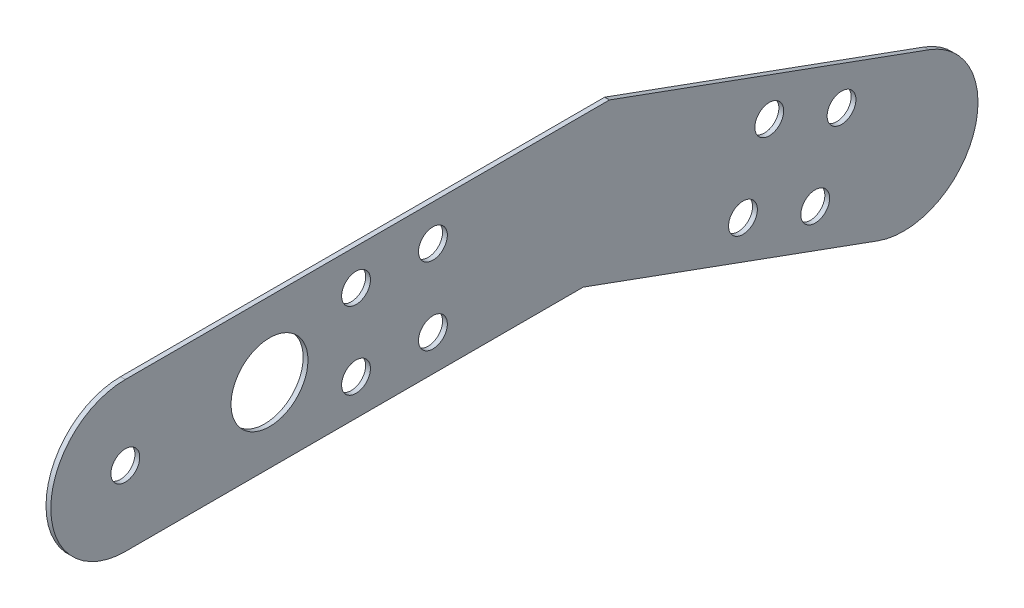
from build123d import *

# Parameters (mm, degrees)
CROQUIS1_R        = 1.5
CROQUIS1_R_2      = 4
BRIDA_BASE1_DEPTH = 0.5


# Sheet-metal steps are written as plain solids
with BuildPart() as part:
    # Croquis1 → Brida base1 (new body)
    with BuildSketch(Plane(origin=(0, 0, 0), x_dir=(0, 0, -1), z_dir=(1, 0, 0))):
        with BuildLine():
            Line((-43.604767051, 5.805989848), (4.028698849, 5.805989848))
            Line((4.028698849, 5.805989848), (34.694125945, -5.355312836))
            ThreePointArc((34.694125945, -5.355312836), (44.627399867, -0.723351136), (39.995438167, 9.209922786))
            Line((39.995438167, 9.209922786), (6.76176705, 21.305989848))
            Line((6.76176705, 21.305989848), (-43.604767051, 21.305989848))
            ThreePointArc((-43.604767051, 21.305989848), (-51.354767051, 13.555989848), (-43.604767051, 5.805989848))
        make_face()
        with Locations((-19.604767051, 17.555989848)):
            Circle(CROQUIS1_R, mode=Mode.SUBTRACT)
        with Locations(Location((-19.604767051, 9.555989848, 0), (0, 0, 180))):
            Circle(CROQUIS1_R, mode=Mode.SUBTRACT)
        with Locations((-43.604767051, 13.555989848)):
            Circle(CROQUIS1_R, mode=Mode.SUBTRACT)
        with Locations((23.380149081, 11.2667268)):
            Circle(CROQUIS1_R, mode=Mode.SUBTRACT)
        with Locations(Location((20.643987934, 3.749185834, 0), (0, 0, 180))):
            Circle(CROQUIS1_R, mode=Mode.SUBTRACT)
        with Locations((-28.604767051, 13.555989848)):
            Circle(CROQUIS1_R_2, mode=Mode.SUBTRACT)
        with Locations((30.897690047, 8.530565653)):
            Circle(CROQUIS1_R, mode=Mode.SUBTRACT)
        with Locations(Location((28.161528901, 1.013024687, 0), (0, 0, 180))):
            Circle(CROQUIS1_R, mode=Mode.SUBTRACT)
        with Locations((-11.604767051, 17.555989848)):
            Circle(CROQUIS1_R, mode=Mode.SUBTRACT)
        with Locations(Location((-11.604767051, 9.555989848, 0), (0, 0, 180))):
            Circle(CROQUIS1_R, mode=Mode.SUBTRACT)
    extrude(amount=-BRIDA_BASE1_DEPTH)


solid = part.part
